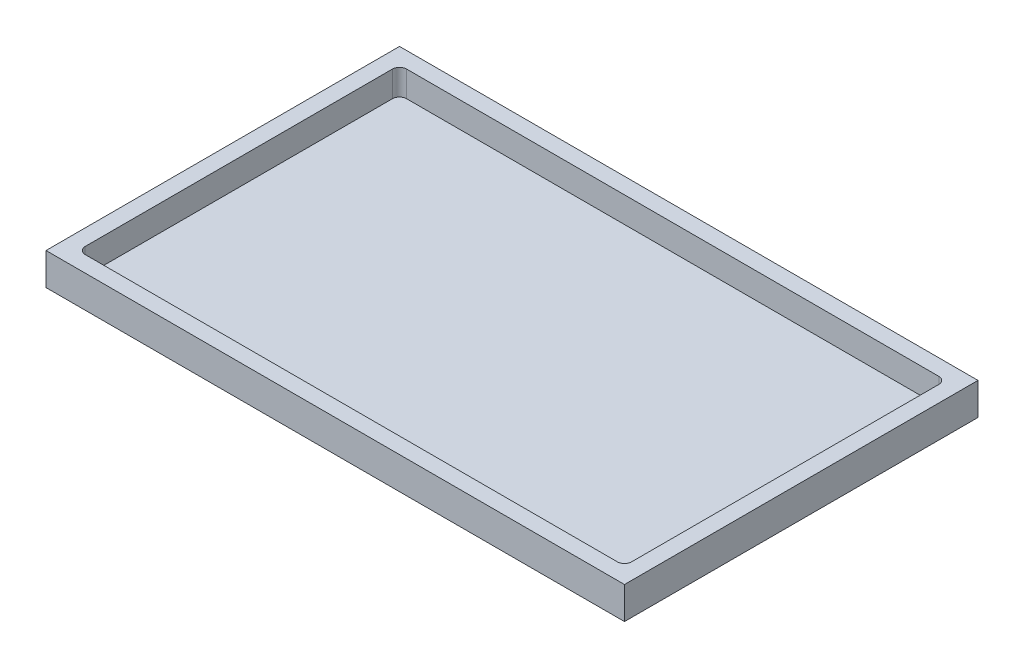
from build123d import *

# Parameters (mm, degrees)
SKETCH1_W           = 900
SKETCH1_H           = 550
BOSS_EXTRUDE1_DEPTH = 50
SKETCH2_W           = 850
SKETCH2_H           = 500
CUT_EXTRUDE1_DEPTH  = 40
FILLET1_R           = 11


with BuildPart() as part:
    # Sketch1 → Boss-Extrude1 (new body)
    with BuildSketch(Plane(origin=(0, 0, 0), x_dir=(1, 0, 0), z_dir=(0, 1, 0))):
        Rectangle(SKETCH1_W, SKETCH1_H)
    extrude(amount=BOSS_EXTRUDE1_DEPTH)

    # Sketch2 → Cut-Extrude1 (cut)
    with BuildSketch(Plane(origin=(0, 50, 0), x_dir=(1, 0, 0), z_dir=(0, 1, 0))):
        Rectangle(SKETCH2_W, SKETCH2_H)
    extrude(amount=-CUT_EXTRUDE1_DEPTH, mode=Mode.SUBTRACT)

    # Fillet1
    fillet1_edges = [part.edges().sort_by_distance(p)[0] for p in [
        (-425, 30, 250),
        (-425, 30, -250),
        (425, 30, -250),
        (425, 30, 250),
    ]]
    fillet(fillet1_edges, radius=FILLET1_R)


solid = part.part
